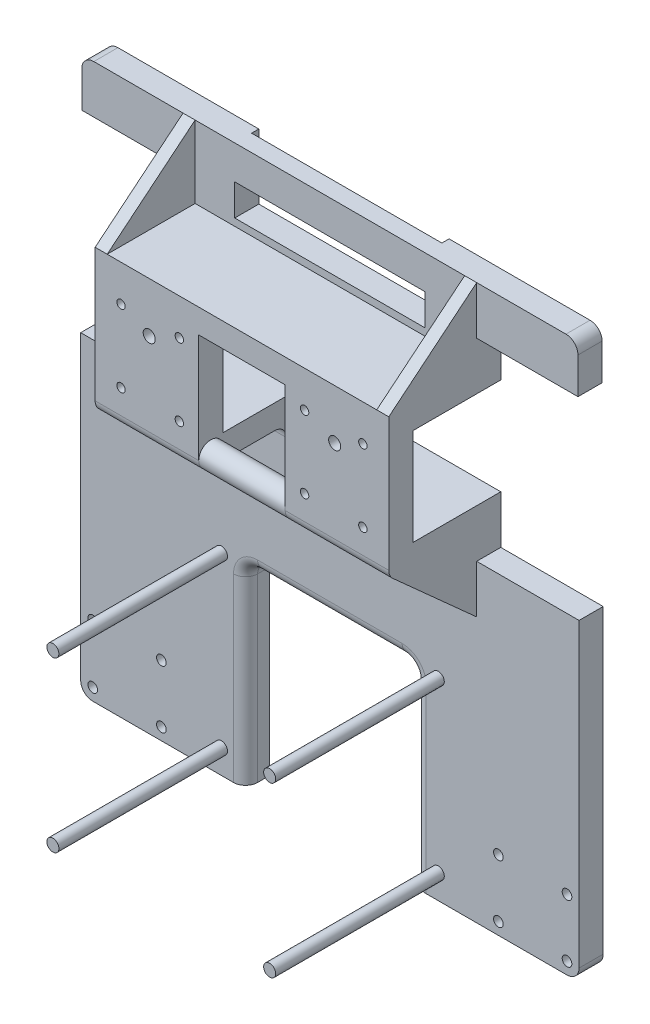
from build123d import *

# Parameters (mm, degrees)
SKETCH_2_W          = 43
SKETCH_2_H          = 40.2
SKETCH_2_R          = 1.75
EXTRUDE_1_DEPTH     = 10
EXTRUDE_1_2_DEPTH   = 10
SKETCH_3_W          = 43
SKETCH_3_H          = 36.5
EXTRUDE_2_DEPTH     = 10
SKETCH_4_W          = 121.9
SKETCH_4_H          = 150
EXTRUDE_3_DEPTH     = 10
SKETCH_6_W          = 121.9
SKETCH_6_H          = 36.5
EXTRUDE_4_DEPTH     = 10
EXTRUDE_5_REACH     = 285.745
SKETCH_7_R          = 5
FILLET_1_R          = 5
FILLET_2_R          = 5
EXTRUDE_6_DEPTH     = 10
SKETCH_9_W          = 79
SKETCH_9_H          = 27
CUT_EXTRUDE_1_DEPTH = 3
SKETCH_10_W         = 79
SKETCH_10_H         = 13
CUT_EXTRUDE_2_DEPTH = 293.327316548
RIB_16_REACH        = 320.066
SKETCH_11_WALL_W    = 685.378322466
SKETCH_11_WALL_H    = 5
SKETCH_12_W         = 10
SKETCH_12_H         = 130
EXTRUDE_7_DEPTH     = 42.5
SKETCH_13_R         = 2
CUT_EXTRUDE_3_DEPTH = 42.5
SKETCH_14_R         = 2.5
EXTRUDE_8_DEPTH     = 70
SKETCH_15_W         = 70
SKETCH_15_H         = 80
CUT_EXTRUDE_4_DEPTH = 60
RIB_17_REACH        = 321.176
SKETCH_16_WALL_W    = 687.174412562
SKETCH_16_WALL_H    = 5
FILLET_4_R          = 5
FILLET_5_R          = 5
FILLET_6_R          = 5
SKETCH_17_R         = 2.5
CUT_EXTRUDE_5_DEPTH = 293.947371553


with BuildPart() as part:
    # 草图2 → 凸台-拉伸1 (new body)
    with BuildSketch(Plane.XY):
        with Locations((-39.45, -100)):
            Rectangle(SKETCH_2_W, SKETCH_2_H)
        with Locations((-50.2, -85)):
            Circle(SKETCH_2_R, mode=Mode.SUBTRACT)
        with Locations((-26, -85)):
            Circle(SKETCH_2_R, mode=Mode.SUBTRACT)
        with Locations((-50.2, -115)):
            Circle(SKETCH_2_R, mode=Mode.SUBTRACT)
        with Locations((-26, -115)):
            Circle(SKETCH_2_R, mode=Mode.SUBTRACT)
    extrude(amount=EXTRUDE_1_DEPTH)



with BuildPart() as body_2:
    # 草图2 → Extrude 1 2 (new body)
    with BuildSketch(Plane.XY):
        with Locations((39.45, -100)):
            Rectangle(SKETCH_2_W, SKETCH_2_H)
        with Locations((50.2, -85)):
            Circle(SKETCH_2_R, mode=Mode.SUBTRACT)
        with Locations((26, -85)):
            Circle(SKETCH_2_R, mode=Mode.SUBTRACT)
        with Locations((26, -115)):
            Circle(SKETCH_2_R, mode=Mode.SUBTRACT)
        with Locations((50.2, -115)):
            Circle(SKETCH_2_R, mode=Mode.SUBTRACT)
    extrude(amount=EXTRUDE_1_2_DEPTH)


with BuildPart() as part_1:
    add(part.part)

    add(body_2.part)  # 凸台-拉伸2 merges body 2
    # 草图3 → 凸台-拉伸2 (add)
    with BuildSketch(Plane.XZ.offset(120.1)):
        with Locations((39.45, -8.25)):
            Rectangle(SKETCH_3_W, SKETCH_3_H)
        with Locations((-39.45, -8.25)):
            Rectangle(SKETCH_3_W, SKETCH_3_H)
    extrude(amount=EXTRUDE_2_DEPTH)

    # 草图4 → 凸台-拉伸3 (add)
    with BuildSketch(Plane(origin=(0, 0, -26.5), x_dir=(-1, 0, 0), z_dir=(0, 0, -1))):
        with Locations((0, -195.1)):
            Rectangle(SKETCH_4_W, SKETCH_4_H)
    extrude(amount=EXTRUDE_3_DEPTH)

    # 草图6 → 凸台-拉伸4 (add)
    with BuildSketch(Plane(origin=(0, -79.9, 0), x_dir=(1, 0, 0), z_dir=(0, 1, 0))):
        with Locations((0, 8.25)):
            Rectangle(SKETCH_6_W, SKETCH_6_H)
    extrude(amount=EXTRUDE_4_DEPTH)

    # 草图7 → 凸台-拉伸5 (add, up to next)
    with BuildSketch(Plane.ZY.offset(-17.95), mode=Mode.PRIVATE) as extrude_5_sk1:
        with Locations((5, -125.1)):
            Circle(SKETCH_7_R)
    extrude_5_tool1 = extrude(extrude_5_sk1.sketch, amount=EXTRUDE_5_REACH, mode=Mode.PRIVATE) - part_1.part
    add(extrude_5_tool1.solids().sort_by_distance((17.95, -125.1, 5))[0])

    # 圆角1
    fillet_1_edges = [part_1.edges().sort_by_distance(p)[0] for p in [
        (-39.45, -130.1, 10),
        (39.45, -130.1, 10),
    ]]
    fillet(fillet_1_edges, radius=FILLET_1_R)

    # 圆角2
    fillet_2_edges = [part_1.edges().sort_by_distance(p)[0] for p in [
        (-39.45, -130.1, -26.5),
        (39.45, -130.1, -26.5),
    ]]
    fillet(fillet_2_edges, radius=FILLET_2_R)

    # 草图8 → 凸台-拉伸6 (add)
    with BuildSketch(Plane(origin=(0, 0, -26.5), x_dir=(-1, 0, 0), z_dir=(0, 0, -1))):
        Polygon((-60.95, -79.9), (60.95, -79.9), (60.95, -59.9), (103, -59.9), (103, -39.9), (-103, -39.9), (-103, -59.9), (-60.95, -59.9), align=None)
    extrude(amount=EXTRUDE_6_DEPTH)

    # 草图9 → 切除-拉伸1 (cut)
    with BuildSketch(Plane(origin=(0, 0, -36.5), x_dir=(-1, 0, 0), z_dir=(0, 0, -1))):
        with Locations((0, -53.4)):
            Rectangle(SKETCH_9_W, SKETCH_9_H)
    extrude(amount=-CUT_EXTRUDE_1_DEPTH, mode=Mode.SUBTRACT)

    # 草图10 → 切除-拉伸2 (cut, through all)
    with BuildSketch(Plane(origin=(0, 0, -33.5), x_dir=(-1, 0, 0), z_dir=(0, 0, -1))):
        with Locations((0, -60.4)):
            Rectangle(SKETCH_10_W, SKETCH_10_H)
    extrude(amount=-CUT_EXTRUDE_2_DEPTH, mode=Mode.SUBTRACT)

    # 草图11 wall → 筋16 (add, up to next)
    with BuildSketch(Plane(origin=(-60.95, -54.9, -8.25), x_dir=(0, 0.634965075677, -0.772540842073), z_dir=(0, -0.772540842073, -0.634965075677)), mode=Mode.PRIVATE) as rib_16_sk1:
        with Locations((0, 2.5)):
            Rectangle(SKETCH_11_WALL_W, SKETCH_11_WALL_H)
    rib_16_tool1 = extrude(rib_16_sk1.sketch, amount=RIB_16_REACH, mode=Mode.PRIVATE) - part_1.part
    rib_16 = rib_16_tool1.solids().sort_by_distance((-60.95, -54.9, -8.25))[0]
    add(rib_16)

    # 镜向1: 筋16 across plane
    add(rib_16.mirror(Plane(origin=(0, 0, 0), x_dir=(0, 0, 1), z_dir=(1, 0, 0))))

    # 草图12 → 凸台-拉伸7 (add)
    with BuildSketch(Plane.ZY.offset(60.95)):
        with Locations((-31.5, -205.1)):
            Rectangle(SKETCH_12_W, SKETCH_12_H)
    extrude_7 = extrude(amount=EXTRUDE_7_DEPTH)

    # 镜向2: 凸台-拉伸7 across plane
    add(extrude_7.mirror(Plane(origin=(0, 0, 0), x_dir=(0, 0, 1), z_dir=(1, 0, 0))))

    # 草图13 → 切除-拉伸3 (cut)
    with BuildSketch(Plane.XY.offset(-26.5)):
        with Locations((98.45, -265.1)):
            Circle(SKETCH_13_R)
        with Locations((98.45, -241.1)):
            Circle(SKETCH_13_R)
        with Locations((69.95, -265.1)):
            Circle(SKETCH_13_R)
        with Locations((69.95, -241.1)):
            Circle(SKETCH_13_R)
    cut_extrude_3 = extrude(amount=-CUT_EXTRUDE_3_DEPTH, mode=Mode.SUBTRACT)

    # 镜向3: 切除-拉伸3 across plane
    add(cut_extrude_3.mirror(Plane(origin=(0, 0, 0), x_dir=(0, 0, 1), z_dir=(1, 0, 0))), mode=Mode.SUBTRACT)

    # 草图14 → 凸台-拉伸8 (add)
    with BuildSketch(Plane.XY.offset(-26.5)):
        with Locations((-45, -260.1)):
            Circle(SKETCH_14_R)
        with Locations((45, -260.1)):
            Circle(SKETCH_14_R)
        with Locations((-45, -190.1)):
            Circle(SKETCH_14_R)
        with Locations((45, -190.1)):
            Circle(SKETCH_14_R)
    extrude(amount=EXTRUDE_8_DEPTH)

    # 草图15 → 切除-拉伸4 (cut)
    with BuildSketch(Plane.XY.offset(-26.5)):
        with Locations((0, -230.1)):
            Rectangle(SKETCH_15_W, SKETCH_15_H)
    extrude(amount=-CUT_EXTRUDE_4_DEPTH, mode=Mode.SUBTRACT)

    # 草图16 wall → 筋17 (add, up to next)
    with BuildSketch(Plane(origin=(-60.95, -144.460273185, -9.079855192), x_dir=(0, -0.668057923191, -0.744109273737), z_dir=(0, -0.744109273737, 0.668057923191)), mode=Mode.PRIVATE) as rib_17_sk1:
        with Locations((0, 2.5)):
            Rectangle(SKETCH_16_WALL_W, SKETCH_16_WALL_H)
    rib_17_tool1 = extrude(rib_17_sk1.sketch, amount=-RIB_17_REACH, mode=Mode.PRIVATE) - part_1.part
    rib_17 = rib_17_tool1.solids().sort_by_distance((-60.95, -144.460273185, -9.079855192))[0]
    add(rib_17)

    # 镜向4: 筋17 across plane
    add(rib_17.mirror(Plane(origin=(0, 0, 0), x_dir=(0, 0, 1), z_dir=(1, 0, 0))))

    # 圆角4
    fillet_4_edges = [part_1.edges().sort_by_distance(p)[0] for p in [
        (103, -39.9, -31.5),
        (-103, -39.9, -31.5),
    ]]
    fillet(fillet_4_edges, radius=FILLET_4_R)

    # 圆角5
    fillet_5_edges = [part_1.edges().sort_by_distance(p)[0] for p in [
        (103.45, -270.1, -31.5),
        (-103.45, -270.1, -31.5),
    ]]
    fillet(fillet_5_edges, radius=FILLET_5_R)

    # 圆角6
    fillet_6_edges = [part_1.edges().sort_by_distance(p)[0] for p in [
        (-35, -190.1, -31.5),
        (35, -190.1, -31.5),
        (-35, -230.1, -26.5),
        (0, -190.1, -26.5),
        (35, -230.1, -26.5),
    ]]
    fillet(fillet_6_edges, radius=FILLET_6_R)

    # 草图17 → 切除-拉伸5 (cut, through all)
    with BuildSketch(Plane.XY.offset(10)):
        with Locations((38.5, -90.6)):
            Circle(SKETCH_17_R)
        with Locations((-38.5, -90.6)):
            Circle(SKETCH_17_R)
    extrude(amount=-CUT_EXTRUDE_5_DEPTH, mode=Mode.SUBTRACT)


solid = part_1.part
